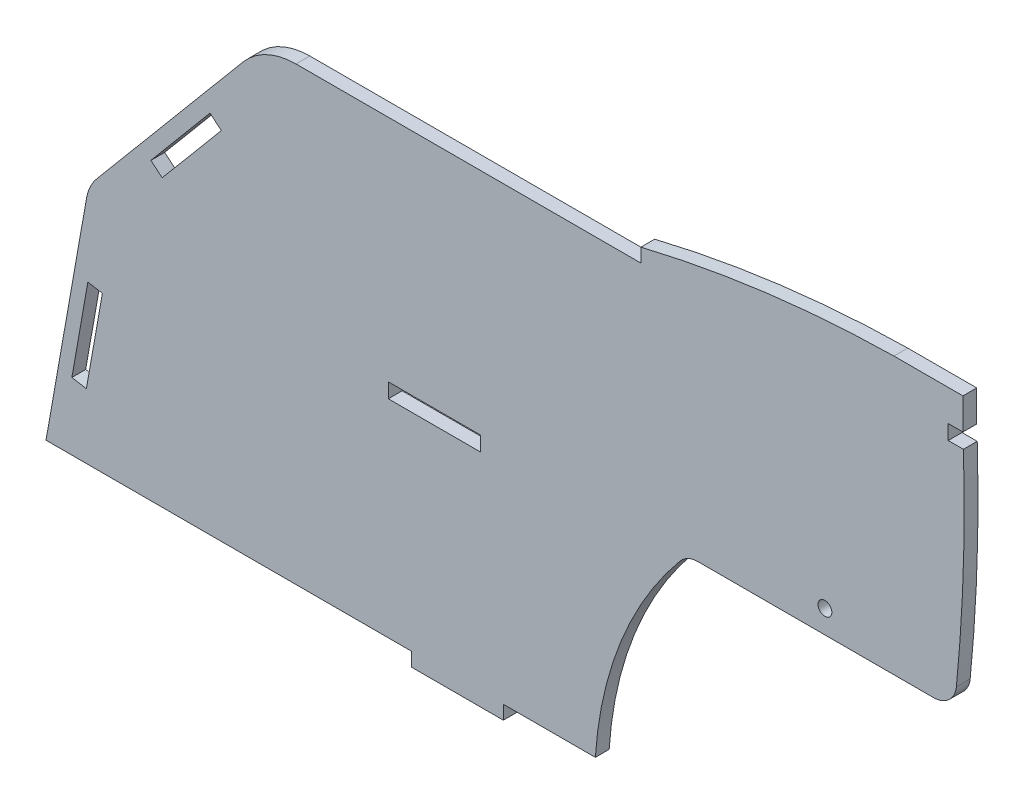
from build123d import *

# Parameters (mm, degrees)
SKETCH1_R           = 1.5
SKETCH1_W           = 20
SKETCH1_H           = 3.2
BOSS_EXTRUDE1_DEPTH = 3
SKETCH2_W           = 3.5
SKETCH2_H           = 3.2
CUT_EXTRUDE1_DEPTH  = 10


with BuildPart() as part:
    # Sketch1 → Boss-Extrude1 (new body)
    with BuildSketch(Plane.XY):
        with BuildLine():
            Line((-45.069342458, 73), (29.899619737, 73))
            Line((29.899619737, 73), (29.899619737, 76))
            ThreePointArc((29.899619737, 76), (57.204966695, 81.029416759), (84.899619737, 83))
            Line((84.899619737, 83), (99.899619737, 83))
            Line((99.899619737, 83), (99.899619737, 76))
            ThreePointArc((99.899619737, 76), (100.028952106, 51.728920833), (98.475860861, 27.507238018))
            ThreePointArc((98.475860861, 27.507238018), (96.856999877, 24.294341495), (93.500201545, 23))
            Line((93.500201545, 23), (42.291738963, 23))
            ThreePointArc((42.291738963, 23), (40.174307059, 22.52951235), (38.455365379, 21.206592853))
            ThreePointArc((38.455365379, 21.206592853), (25.544096759, -0.425443304), (20, -25))
            Line((20, -25), (0, -25))
            Line((0, -25), (0, -27.9998915))
            Line((0, -27.9998915), (-20, -27.9998915))
            Line((-20, -27.9998915), (-20, -25))
            Line((-20, -25), (-99.408174518, -25))
            Line((-99.408174518, -25), (-90.591825482, 25))
            ThreePointArc((-90.591825482, 25), (-89.806825823, 27.489700841), (-88.404192383, 29.69139432))
            Line((-88.404192383, 29.69139432), (-56.560009105, 67.641814145))
            ThreePointArc((-56.560009105, 67.641814145), (-51.408616384, 71.594616806), (-45.069342458, 73))
        make_face()
        with Locations((69.899619737, 28)):
            Circle(SKETCH1_R, mode=Mode.SUBTRACT)
        with Locations((-15, 21.6)):
            Rectangle(SKETCH1_W, SKETCH1_H, mode=Mode.SUBTRACT)
        Polygon((-76.611843512, 39.077796972), (-74.160501294, 37.020876622), (-61.3047491, 52.341765484), (-63.756091318, 54.398685835), align=None, mode=Mode.SUBTRACT)
        Polygon((-93.782058518, -10.369022063), (-90.309094964, 9.327132997), (-87.157710155, 8.771458829), (-90.630673708, -10.924696232), align=None, mode=Mode.SUBTRACT)
    extrude(amount=BOSS_EXTRUDE1_DEPTH)

    # Sketch2 → Cut-Extrude1 (cut)
    with BuildSketch(Plane.XY.offset(3)):
        with Locations((98.451878936, 74.6)):
            Rectangle(SKETCH2_W, SKETCH2_H)
    extrude(amount=-CUT_EXTRUDE1_DEPTH, mode=Mode.SUBTRACT)


solid = part.part
